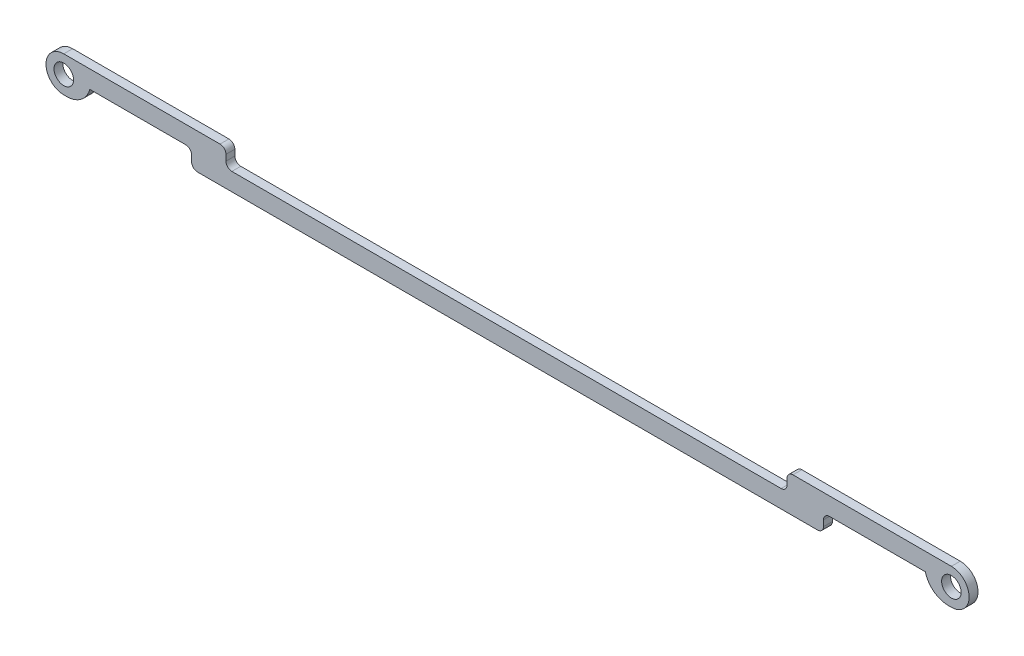
from build123d import *

# Parameters (mm, degrees)
SKETCH_1_R          = 5.5
EXTRUDE_1_DEPTH     = 5
SCALE_1_SCALE       = 0.3
SKETCH_3_W          = 17.210108286
SKETCH_3_H          = 5.437935386
CUT_EXTRUDE_2_DEPTH = 20
FILLET_1_R          = 4
FILLET_2_R          = 1
SKETCH_4_W          = 94.817377104
SKETCH_4_H          = 9.548741528
CUT_EXTRUDE_3_DEPTH = 20
FILLET_3_R          = 1


with BuildPart() as part:
    # 草图1 → 凸台-拉伸1 (new body)
    with BuildSketch(Plane.XY):
        with BuildLine():
            Line((0, 10), (500, 10))
            ThreePointArc((500, 10), (510, 0), (500, -10))
            Line((500, -10), (0, -10))
            ThreePointArc((0, -10), (-10, 0), (0, 10))
        make_face()
        Circle(SKETCH_1_R, mode=Mode.SUBTRACT)
        with Locations((500, 0)):
            Circle(SKETCH_1_R, mode=Mode.SUBTRACT)
    extrude(amount=EXTRUDE_1_DEPTH)


with BuildPart() as part_1:
    # 缩放比例1: scaled about (0, 0, 0)
    add(part.part.scale(SCALE_1_SCALE))

    # 草图3 → 切除-拉伸2 (cut)
    with BuildSketch(Plane.XY.offset(1.5)):
        with Locations((13.002886653, -2.718967693)):
            Rectangle(SKETCH_3_W, SKETCH_3_H)
        with Locations((136.997113347, -2.718967693)):
            Rectangle(SKETCH_3_W, SKETCH_3_H)
    extrude(amount=-CUT_EXTRUDE_2_DEPTH, mode=Mode.SUBTRACT)

    # 圆角1
    # the kernel refuses this fillet: 4 mm, written as the material it takes off along each edge
    with BuildSketch(Plane(origin=(145.60216749, -3, 11.182458366), x_dir=(1, 0, 0), z_dir=(0, 0, -1))) as fillet_1_piece_1:
        with BuildLine():
            CenterArc((3.872983346, -4), FILLET_1_R, 90, 75.522487814)
            Line((0, -3), (-0.077459667, -2.98))
            ThreePointArc((-0.077459667, -2.98), (-0.08, -1.5), (-0.08, 0))
            Line((-0.08, 0), (0, 0.08))
            Line((0, 0.08), (3.872983346, 0.08))
            Line((3.872983346, 0.08), (3.872983346, 0))
        make_face()
    extrude(amount=20.864916731, mode=Mode.SUBTRACT)
    with BuildSketch(Plane(origin=(4.39783251, -3, 11.182458366), x_dir=(-1, 0, 0), z_dir=(0, 0, -1))) as fillet_1_piece_2:
        with BuildLine():
            CenterArc((3.872983346, 4), FILLET_1_R, 194.477512186, 75.522487814)
            Line((0, 3), (-0.077459667, 2.98))
            ThreePointArc((-0.077459667, 2.98), (-0.08, 1.5), (-0.08, 0))
            Line((-0.08, 0), (0, -0.08))
            Line((0, -0.08), (3.872983346, -0.08))
            Line((3.872983346, -0.08), (3.872983346, 0))
        make_face()
    extrude(amount=20.864916731, mode=Mode.SUBTRACT)

    # 圆角2
    fillet_2_edges = [part_1.edges().sort_by_distance(p)[0] for p in [
        (128.392059204, -3, 0.75),
        (21.607940796, -3, 0.75),
        (21.607940796, 0, 0.75),
        (128.392059204, 0, 0.75),
    ]]
    fillet(fillet_2_edges, radius=FILLET_2_R)

    # 草图4 → 切除-拉伸3 (cut)
    with BuildSketch(Plane.XY.offset(1.5)):
        with Locations((74.821866685, 4.774370764)):
            Rectangle(SKETCH_4_W, SKETCH_4_H)
    extrude(amount=-CUT_EXTRUDE_3_DEPTH, mode=Mode.SUBTRACT)

    # 圆角3
    fillet_3_edges = [part_1.edges().sort_by_distance(p)[0] for p in [
        (122.230555237, 3, 0.75),
        (27.413178133, 3, 0.75),
        (122.230555237, 0, 0.75),
        (27.413178133, 0, 0.75),
    ]]
    fillet(fillet_3_edges, radius=FILLET_3_R)


solid = part_1.part
